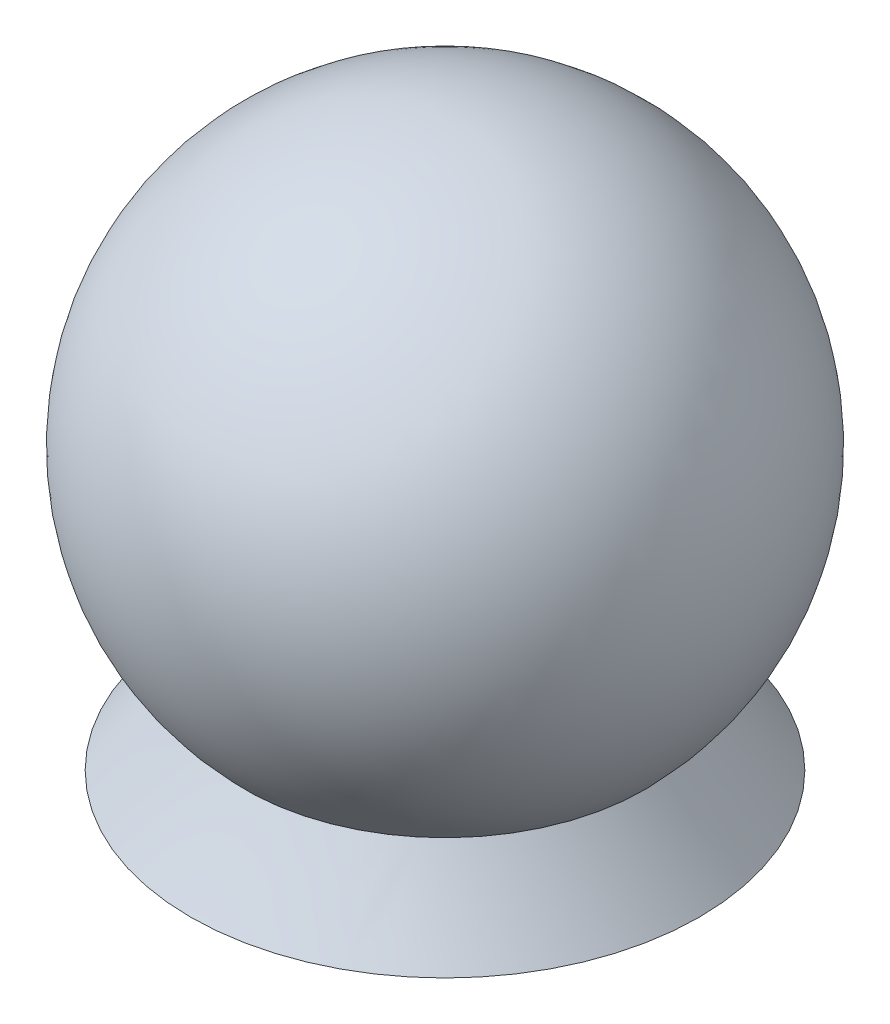
from build123d import *


with BuildPart() as part:
    # 로프트1: read off the stored shape, not the designer's step
    # 로프트1: loft between two sections, ruled curve by curve
    loft_1_from = [
        Edge.make_bspline([(0.942516398, 0, 1.763990601), (4.470497599, 0, -0.121042196), (2.585464803, 0, -3.649023397), (-0.942516398, 0, -1.763990601), (-4.470497599, 0, 0.121042196), (-2.585464803, 0, 3.649023397), (0.942516398, 0, 1.763990601)], [0, 0, 0, 0, 0.5, 0.5, 0.5, 1, 1, 1, 1], 3, [1, 0.333333333, 0.333333333, 1, 0.333333333, 0.333333333, 1]),
    ]
    loft_1_to = [
        Edge.make_bspline([(1.026190487, 1, 0.901276533), (2.828743553, 1, -1.151104441), (0.776362579, 1, -2.953657507), (-1.026190487, 1, -0.901276533), (-2.828743553, 1, 1.151104441), (-0.776362579, 1, 2.953657507), (1.026190487, 1, 0.901276533)], [0, 0, 0, 0, 0.5, 0.5, 0.5, 1, 1, 1, 1], 3, [1, 0.333333333, 0.333333333, 1, 0.333333333, 0.333333333, 1]),
    ]
    loft_1 = Solid(Shell([*[Face.make_surface_from_curves(loft_1_from[k], loft_1_to[k]) for k in range(1)], Face(Wire(loft_1_from)), Face(Wire(loft_1_to))]))
    add(loft_1)

    # 스케치2 → 회전2 (revolve)
    with BuildSketch(Plane.XY):
        with BuildLine():
            Line((0, 0), (0, 4.43188316))
            ThreePointArc((0, 4.43188316), (-2.21594158, 2.21594158), (0, 0))
        make_face()
    revolve(axis=Axis((0, 0, 0), (0, 1, 0)))


solid = part.part
